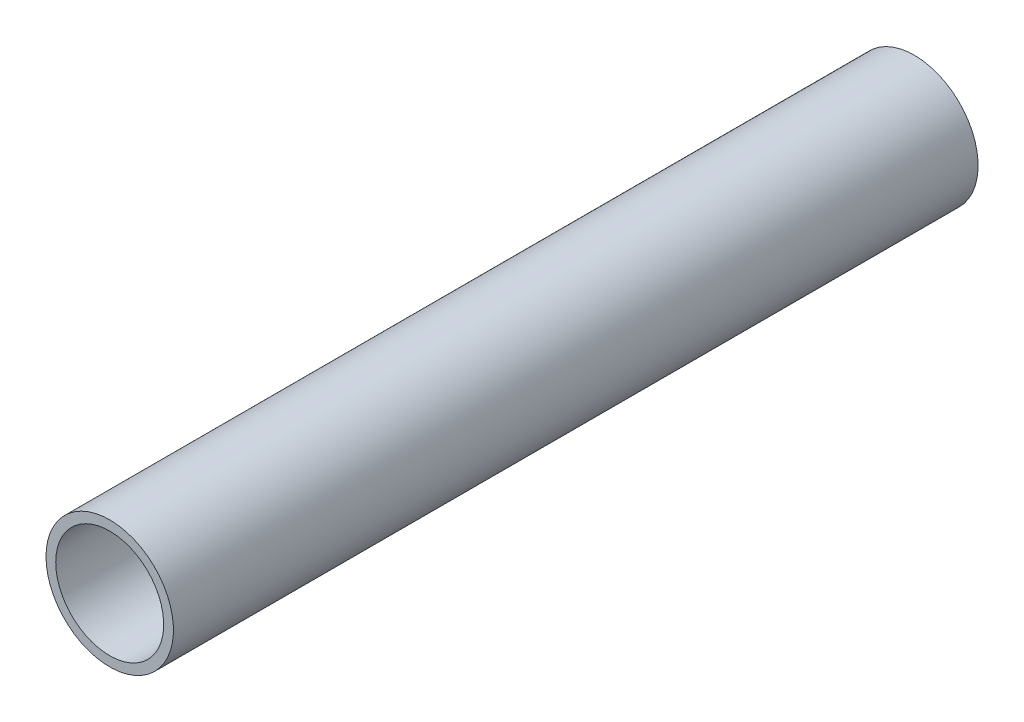
from build123d import *

# Parameters (mm, degrees)
SKETCH2_R              = 24.13
SKETCH2_R_2            = 20.447
BASE_DEPTH             = 304.8
SNAP_RING_GROOVE_START = -6.35
SKETCH3_R              = 21.9075
SKETCH3_R_2            = 20.447
SNAP_RING_GROOVE_DEPTH = 1.7272


with BuildPart() as part:
    # Sketch2 → base (new body)
    with BuildSketch(Plane(origin=(0, 0, 0), x_dir=(0, 1, 0), z_dir=(0, 0, 1))):
        Circle(SKETCH2_R)
        Circle(SKETCH2_R_2, mode=Mode.SUBTRACT)
    extrude(amount=BASE_DEPTH)

    # Sketch3 → snap_ring_groove (cut)
    with BuildSketch(Plane(origin=(0, 0, 0), x_dir=(1, 0, 0), z_dir=(0, 0, -1)).offset(SNAP_RING_GROOVE_START)):
        Circle(SKETCH3_R)
        Circle(SKETCH3_R_2, mode=Mode.SUBTRACT)
    extrude(amount=-SNAP_RING_GROOVE_DEPTH, mode=Mode.SUBTRACT)


solid = part.part
